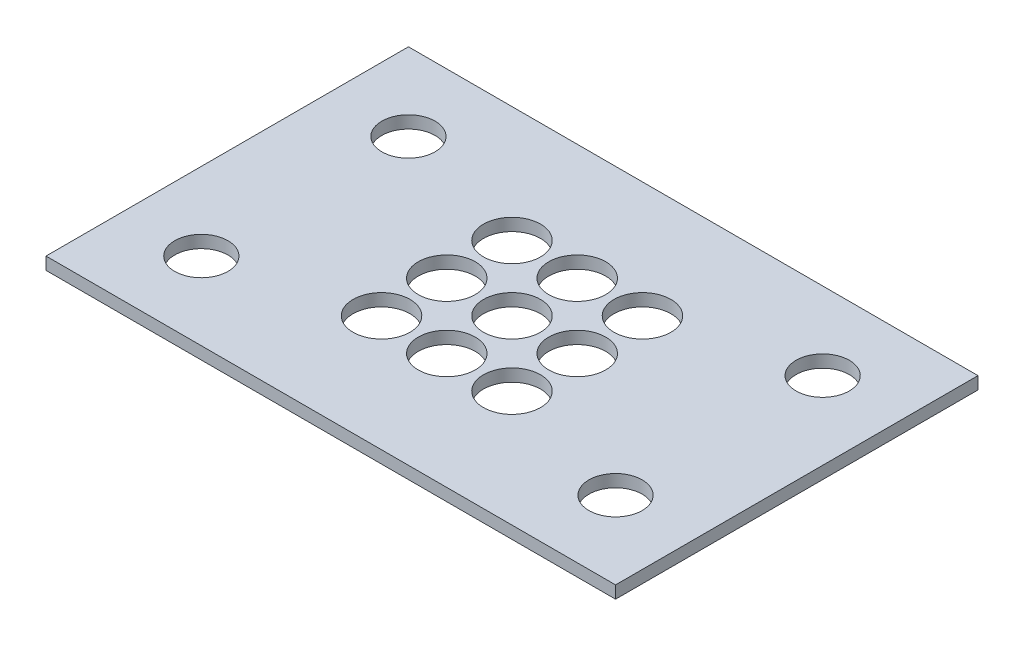
from build123d import *

# Parameters (mm, degrees)
SKETCH1_W           = 69.85
SKETCH1_H           = 44.45
SKETCH1_R           = 3.2639
SKETCH1_R_2         = 3.4925
BOSS_EXTRUDE1_DEPTH = 1.524


with BuildPart() as part:
    # Sketch1 → Boss-Extrude1 (new body)
    with BuildSketch(Plane(origin=(0, 0, 0), x_dir=(1, 0, 0), z_dir=(0, 1, 0))):
        with Locations((34.925, 22.225)):
            Rectangle(SKETCH1_W, SKETCH1_H)
        with Locations((9.525, 9.525)):
            Circle(SKETCH1_R, mode=Mode.SUBTRACT)
        with Locations((26.925, 14.225)):
            Circle(SKETCH1_R_2, mode=Mode.SUBTRACT)
        with Locations((26.925, 22.225)):
            Circle(SKETCH1_R_2, mode=Mode.SUBTRACT)
        with Locations((60.325, 9.525)):
            Circle(SKETCH1_R, mode=Mode.SUBTRACT)
        with Locations((34.925, 14.225)):
            Circle(SKETCH1_R_2, mode=Mode.SUBTRACT)
        with Locations((42.925, 14.225)):
            Circle(SKETCH1_R_2, mode=Mode.SUBTRACT)
        with Locations((26.925, 30.225)):
            Circle(SKETCH1_R_2, mode=Mode.SUBTRACT)
        with Locations((34.925, 30.225)):
            Circle(SKETCH1_R_2, mode=Mode.SUBTRACT)
        with Locations((9.525, 34.925)):
            Circle(SKETCH1_R, mode=Mode.SUBTRACT)
        with Locations((34.925, 22.225)):
            Circle(SKETCH1_R_2, mode=Mode.SUBTRACT)
        with Locations((42.925, 22.225)):
            Circle(SKETCH1_R_2, mode=Mode.SUBTRACT)
        with Locations((42.925, 30.225)):
            Circle(SKETCH1_R_2, mode=Mode.SUBTRACT)
        with Locations((60.325, 34.925)):
            Circle(SKETCH1_R, mode=Mode.SUBTRACT)
    extrude(amount=BOSS_EXTRUDE1_DEPTH)


solid = part.part
